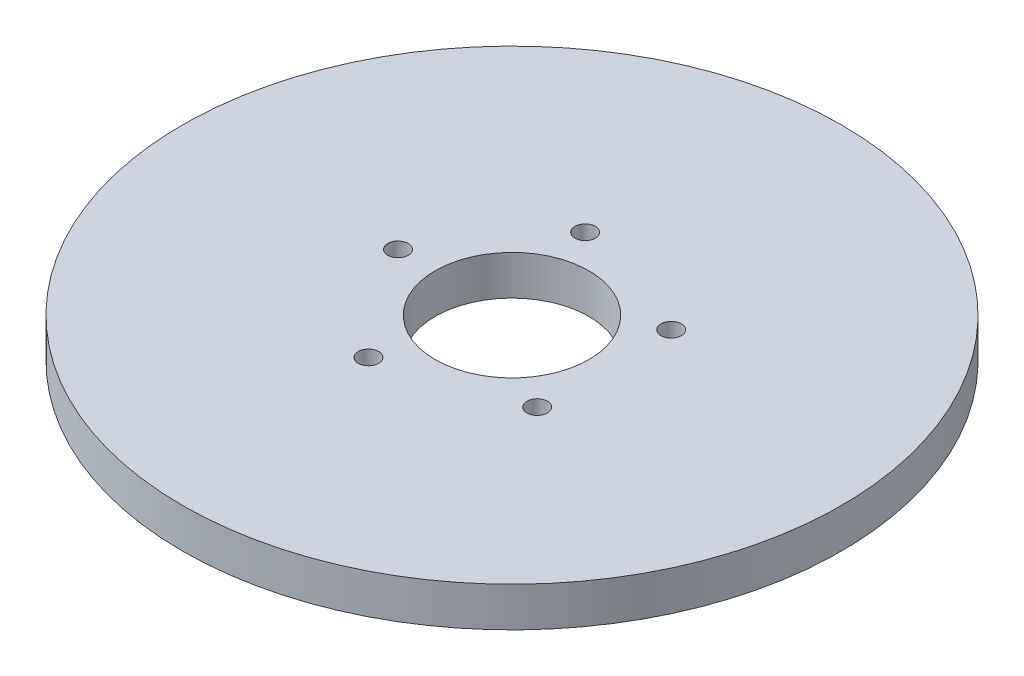
from build123d import *

# Parameters (mm, degrees)
SKETCH1_R           = 75
BOSS_EXTRUDE1_DEPTH = 9
SKETCH2_R           = 17.5
CUT_EXTRUDE1_DEPTH  = 107.447169995
SKETCH3_R           = 2.332409913
CUT_EXTRUDE2_DEPTH  = 8.566412565
CIRPATTERN1_COUNT   = 5


with BuildPart() as part:
    # Sketch1 → Boss-Extrude1 (new body)
    with BuildSketch(Plane(origin=(0, 0, 0), x_dir=(1, 0, 0), z_dir=(0, 1, 0))):
        Circle(SKETCH1_R)
    extrude(amount=BOSS_EXTRUDE1_DEPTH)

    # Sketch2 → Cut-Extrude1 (cut, through all)
    with BuildSketch(Plane(origin=(0, 0, 0), x_dir=(1, 0, 0), z_dir=(0, 1, 0))):
        Circle(SKETCH2_R)
    extrude(amount=CUT_EXTRUDE1_DEPTH, mode=Mode.SUBTRACT)

    # Sketch3 → Cut-Extrude2 (cut)
    with BuildSketch(Plane(origin=(0, 9, 0), x_dir=(1, 0, 0), z_dir=(0, 1, 0))):
        with Locations((-25.937797065, 0)):
            Circle(SKETCH3_R)
    cut_extrude2 = extrude(amount=-CUT_EXTRUDE2_DEPTH, mode=Mode.SUBTRACT)

    # CirPattern1: Cut-Extrude2 ×5 about axis
    cirpattern1_axis = Axis((0, 0, 0), (0, 1, 0))
    for i in range(1, CIRPATTERN1_COUNT):
        add(cut_extrude2.rotate(cirpattern1_axis, i * 360 / CIRPATTERN1_COUNT), mode=Mode.SUBTRACT)


solid = part.part
